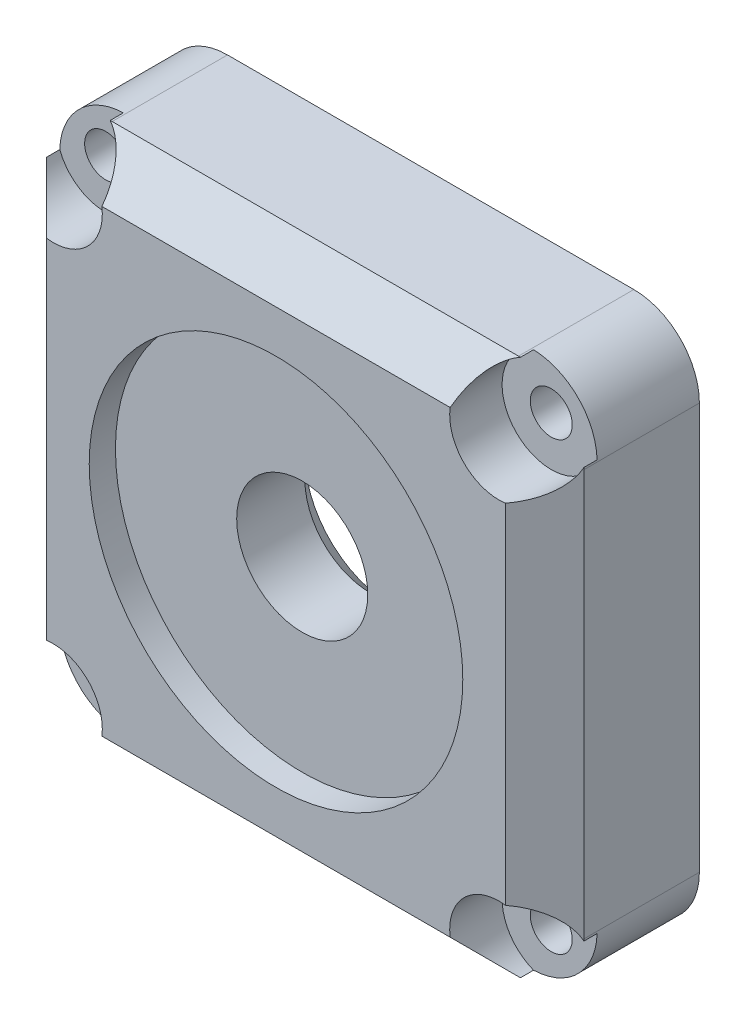
from build123d import *

# Parameters (mm, degrees)
SKETCH_1_W          = 41
SKETCH_1_H          = 41
EXTRUDE_1_DEPTH     = 11.8
CHAMFER_1_SIZE      = 3
FILLET_1_R          = 5
SKETCH_3_R          = 16.5
CUT_EXTRUDE_2_DEPTH = 3
SKETCH_4_R          = 5
CUT_EXTRUDE_3_DEPTH = 31.297524651
SKETCH_5_W          = 30
SKETCH_5_H          = 6
CUT_EXTRUDE_4_DEPTH = 3
CHAMFER_2_SIZE      = 1.6
SKETCH_6_R          = 14.25
CUT_EXTRUDE_5_DEPTH = 2
CUT_EXTRUDE_6_DEPTH = 1
SKETCH_8_R          = 1.6
CUT_EXTRUDE_7_DEPTH = 32.300798712
SKETCH_9_R          = 3.75
CUT_EXTRUDE_8_DEPTH = 4


with BuildPart() as part:
    # ｽｹｯﾁ1 → ﾎﾞｽ - 押し出し1 (new body)
    with BuildSketch(Plane.XY):
        Rectangle(SKETCH_1_W, SKETCH_1_H)
    extrude(amount=EXTRUDE_1_DEPTH)

    # 面取り1
    chamfer_1_edges = [part.edges().sort_by_distance(p)[0] for p in [
        (-20.5, 0, 11.8),
        (0, -20.5, 11.8),
        (20.5, 0, 11.8),
        (0, 20.5, 11.8),
    ]]
    chamfer(chamfer_1_edges, length=CHAMFER_1_SIZE)

    # ﾌｨﾚｯﾄ1
    # the kernel refuses this fillet: 5 mm, written as the material it takes off along each edge
    with BuildSketch(Plane(origin=(20.5, -20.5, -12.5), x_dir=(-1, 0, 0), z_dir=(0, 0, 1)), Plane(origin=(20.5, 20.5, -12.5), x_dir=(0, -1, 0), z_dir=(0, 0, 1))) as fillet_1_piece_1:
        with BuildLine():
            CenterArc((FILLET_1_R, -FILLET_1_R), FILLET_1_R, 90, 90)
            Line((0, -FILLET_1_R), (0, 0))
            Line((0, 0), (FILLET_1_R, 0))
        make_face()
    extrude(amount=33.8, mode=Mode.SUBTRACT)
    with BuildSketch(Plane(origin=(-20.5, -20.5, -12.5), x_dir=(1, 0, 0), z_dir=(0, 0, 1)), Plane(origin=(-20.5, 20.5, -12.5), x_dir=(0, -1, 0), z_dir=(0, 0, 1))) as fillet_1_piece_2:
        with BuildLine():
            CenterArc((FILLET_1_R, FILLET_1_R), FILLET_1_R, 180, 90)
            Line((0, FILLET_1_R), (0, 0))
            Line((0, 0), (FILLET_1_R, 0))
        make_face()
    extrude(amount=33.8, mode=Mode.SUBTRACT)
    with BuildSketch(Plane(origin=(-24.666666667, 24.666666667, 4.633333333), x_dir=(-0.408248290463863, -0.816496580927726, -0.408248290463863), z_dir=(0.5773502691896258, -0.5773502691896258, 0.5773502691896258)), Plane(origin=(-24.666666667, -24.666666667, 4.633333333), x_dir=(0.816496580927726, -0.408248290463863, -0.408248290463863), z_dir=(0.5773502691896258, 0.5773502691896258, 0.5773502691896258))) as fillet_1_piece_3:
        with BuildLine():
            CenterArc((FILLET_1_R * 0.57735026919, FILLET_1_R), FILLET_1_R, 210, 60)
            Line((-FILLET_1_R * 0.288675134595, FILLET_1_R * 0.5), (0, 0))
            Line((0, 0), (FILLET_1_R * 0.57735026919, 0))
        make_face()
    extrude(amount=19.629909152, mode=Mode.SUBTRACT)
    with BuildSketch(Plane(origin=(24.666666667, 24.666666667, 4.633333333), x_dir=(0.40824829046386313, -0.816496580927726, -0.40824829046386285), z_dir=(-0.5773502691896258, -0.5773502691896258, 0.5773502691896258)), Plane(origin=(24.666666667, -24.666666667, 4.633333333), x_dir=(-0.816496580927726, -0.40824829046386285, -0.4082482904638632), z_dir=(-0.5773502691896258, 0.5773502691896258, 0.5773502691896258))) as fillet_1_piece_4:
        with BuildLine():
            CenterArc((FILLET_1_R * 0.57735026919, -FILLET_1_R), FILLET_1_R, 90, 60)
            Line((-FILLET_1_R * 0.288675134595, -FILLET_1_R * 0.5), (0, 0))
            Line((0, 0), (FILLET_1_R * 0.57735026919, 0))
        make_face()
    extrude(amount=19.629909152, mode=Mode.SUBTRACT)

    # ｽｹｯﾁ3 → ｶｯﾄ - 押し出し2 (cut)
    with BuildSketch(Plane(origin=(0, 0, 0), x_dir=(-1, 0, 0), z_dir=(0, 0, -1))):
        Circle(SKETCH_3_R)
    extrude(amount=-CUT_EXTRUDE_2_DEPTH, mode=Mode.SUBTRACT)

    # ｽｹｯﾁ4 → ｶｯﾄ - 押し出し3 (cut, through all)
    with BuildSketch(Plane(origin=(0, 0, 3), x_dir=(-1, 0, 0), z_dir=(0, 0, -1))):
        Circle(SKETCH_4_R)
    extrude(amount=-CUT_EXTRUDE_3_DEPTH, mode=Mode.SUBTRACT)

    # ｽｹｯﾁ5 → ｶｯﾄ - 押し出し4 (cut)
    with BuildSketch(Plane(origin=(0, 0, 0), x_dir=(-1, 0, 0), z_dir=(0, 0, -1))):
        with Locations((0, 15.2)):
            Rectangle(SKETCH_5_W, SKETCH_5_H)
        with Locations((0, -15.2)):
            Rectangle(SKETCH_5_W, SKETCH_5_H)
    extrude(amount=-CUT_EXTRUDE_4_DEPTH, mode=Mode.SUBTRACT)

    # 面取り2
    chamfer_2_edges = [part.edges().sort_by_distance(p)[0] for p in [
        (5, 0, 3),
    ]]
    chamfer(chamfer_2_edges, length=CHAMFER_2_SIZE)

    # ｽｹｯﾁ6 → ｶｯﾄ - 押し出し5 (cut)
    with BuildSketch(Plane.XY.offset(11.8)):
        Circle(SKETCH_6_R)
    extrude(amount=-CUT_EXTRUDE_5_DEPTH, mode=Mode.SUBTRACT)

    # ｽｹｯﾁ7 → ｶｯﾄ - 押し出し6 (cut)
    with BuildSketch(Plane(origin=(0, -14.65, 14.65), x_dir=(1, 0, 0), z_dir=(0, -0.7071067811865491, 0.707106781186546))):
        Polygon((0, -7.77314934), (1.812279996, -4.634188309), (-1.812279996, -4.634188309), align=None)
    extrude(amount=-CUT_EXTRUDE_6_DEPTH, mode=Mode.SUBTRACT)

    # ｽｹｯﾁ8 → ｶｯﾄ - 押し出し7 (cut, through all)
    with BuildSketch(Plane.XY.offset(11.8)):
        with Locations((-17, 17)):
            Circle(SKETCH_8_R)
        with Locations((-17, -17)):
            Circle(SKETCH_8_R)
        with Locations((17, -17)):
            Circle(SKETCH_8_R)
        with Locations((17, 17)):
            Circle(SKETCH_8_R)
    extrude(amount=-CUT_EXTRUDE_7_DEPTH, mode=Mode.SUBTRACT)

    # ｽｹｯﾁ9 → ｶｯﾄ - 押し出し8 (cut)
    with BuildSketch(Plane.XY.offset(11.8)):
        with Locations((17, 17)):
            Circle(SKETCH_9_R)
        with Locations((-17, 17)):
            Circle(SKETCH_9_R)
        with Locations((-17, -17)):
            Circle(SKETCH_9_R)
        with Locations((17, -17)):
            Circle(SKETCH_9_R)
    extrude(amount=-CUT_EXTRUDE_8_DEPTH, mode=Mode.SUBTRACT)


solid = part.part
